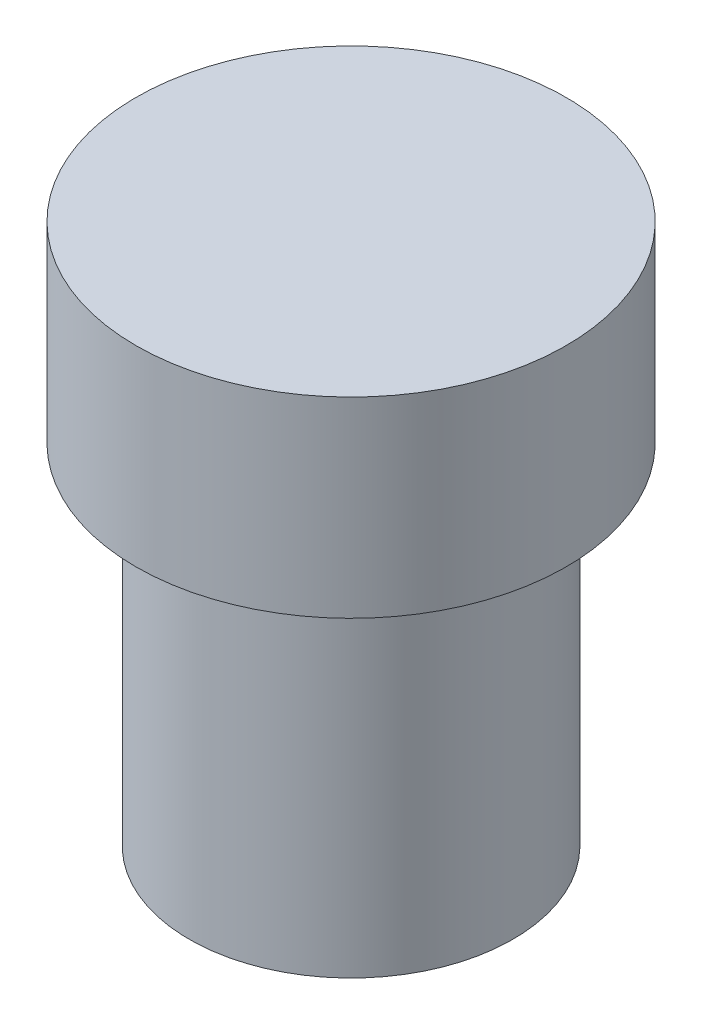
from build123d import *

# Parameters (mm, degrees)
ESBO_O1_R                = 5.05
RESSALTO_EXTRUS_O1_DEPTH = 4.5
ESBO_O2_R                = 3.8
RESSALTO_EXTRUS_O2_DEPTH = 8.2


with BuildPart() as part:
    # Esboço1 → Ressalto-extrusão1 (new body)
    with BuildSketch(Plane(origin=(0, 0, 0), x_dir=(1, 0, 0), z_dir=(0, 1, 0))):
        Circle(ESBO_O1_R)
    extrude(amount=RESSALTO_EXTRUS_O1_DEPTH)

    # Esboço2 → Ressalto-extrusão2 (add)
    with BuildSketch(Plane.XZ):
        Circle(ESBO_O2_R)
    extrude(amount=RESSALTO_EXTRUS_O2_DEPTH)


solid = part.part
